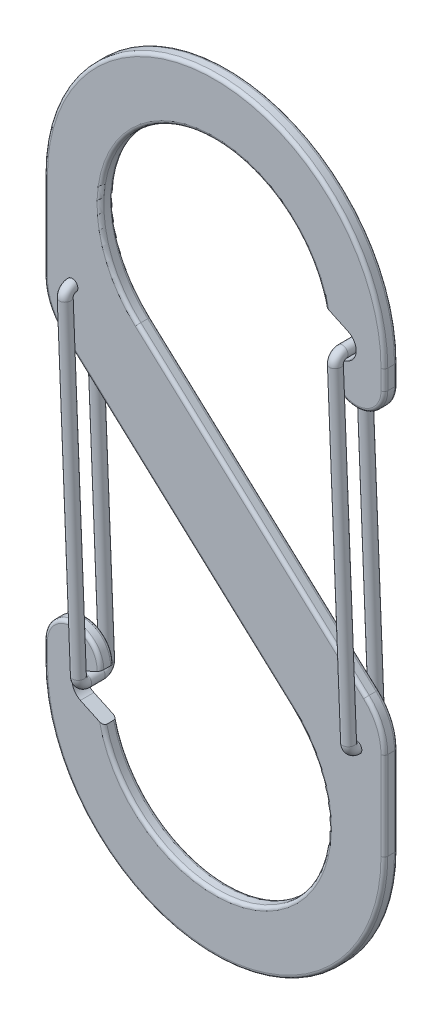
from build123d import *

# Parameters (mm, degrees)
BOSS_EXTRUDE1_DEPTH     = 0.79375
CUT_EXTRUDE1_DEPTH      = 49.955504043
CUT_EXTRUDE1_DEPTH_BACK = 49.955504043
SKETCH2_R               = 0.6604
FILLET1_R               = 6.6675
FILLET2_R               = 0.396875
SKETCH4_R               = 0.6604


with BuildPart() as part:
    # Sketch1 → Boss-Extrude1 (new, symmetric)
    with BuildSketch(Plane.XY):
        with BuildLine():
            Line((7.345443156, 0), (-8.991731826, 14.917615385))
            ThreePointArc((-8.991731826, 14.917615385), (-12.20096244, 19.3836674), (-13.335, 24.765))
            ThreePointArc((-13.335, 24.765), (0, 38.1), (13.335, 24.765))
            Line((13.335, 24.765), (13.335, 22.472049305))
            ThreePointArc((13.335, 22.472049305), (14.302133409, 20.137182714), (16.637, 19.170049305))
            ThreePointArc((16.637, 19.170049305), (18.971866591, 20.137182714), (19.939, 22.472049305))
            Line((19.939, 22.472049305), (19.939, 24.765))
            ThreePointArc((19.939, 24.765), (0, 44.704), (-19.939, 24.765))
            Line((-19.939, 24.765), (-19.939, 11.499285375))
            Line((-19.939, 11.499285375), (-7.345443156, 0))
            Line((-7.345443156, 0), (7.345443156, 0))
        make_face()
    extrude(amount=BOSS_EXTRUDE1_DEPTH, both=True)

    # Sketch2 → Cut-Extrude1 (cut, two sides: drawn at the far end of the back side and taken through both)
    with BuildSketch(Plane.XY.offset(-CUT_EXTRUDE1_DEPTH_BACK)):
        with BuildLine():
            Line((15.68374275, 26.55991435), (0, 33.873363702))
            Line((0, 33.873363702), (0, 16.253836684))
            Line((0, 16.253836684), (15.68374275, 23.567286037))
            ThreePointArc((15.68374275, 23.567286037), (16.637, 25.063600193), (15.68374275, 26.55991435))
        make_face()
        with Locations((-16.637, 15.115503543)):
            Circle(SKETCH2_R)
    extrude(amount=CUT_EXTRUDE1_DEPTH + CUT_EXTRUDE1_DEPTH_BACK, mode=Mode.SUBTRACT)

    # Fillet1
    fillet1_edges = [part.edges().sort_by_distance(p)[0] for p in [
        (-19.939, 11.499285375, 0),
    ]]
    fillet(fillet1_edges, radius=FILLET1_R)

    # Fillet2
    fillet2_edges = [part.edges().sort_by_distance(p)[0] for p in [
        (-0.823144335, 7.458807692, -0.79375),
        (16.637, 19.170049305, -0.79375),
        (19.939, 23.618524653, -0.79375),
        (0, 44.704, -0.79375),
        (-19.939, 19.602519934, -0.79375),
        (-19.37198122, 11.749373567, -0.79375),
        (-0.823144335, 7.458807692, 0.79375),
        (16.637, 19.170049305, 0.79375),
        (19.939, 23.618524653, 0.79375),
        (0, 44.704, 0.79375),
        (-19.939, 19.602519934, 0.79375),
        (-19.37198122, 11.749373567, 0.79375),
        (-6.752681338, 36.263848627, -0.79375),
        (-12.556404534, 4.75817378, -0.79375),
        (-6.752681338, 36.263848627, 0.79375),
        (-12.556404534, 4.75817378, 0.79375),
    ]]
    fillet(fillet2_edges, radius=FILLET2_R)


with BuildPart() as body_2:
    # Mirror1: mirrored copy
    add(part.part.mirror(Plane(origin=(0, 0, 0.79375), x_dir=(0, 0, 1), z_dir=(0, 1, 0))))


with BuildPart() as body_3:
    # Mirror2: mirrored copy
    add(body_2.part.mirror(Plane(origin=(0, 0, 0), x_dir=(0, 0, 1), z_dir=(1, 0, 0))))


with BuildPart() as part_1:
    add(part.part)

    # Combine1: union body 3
    add(body_3.part)


with BuildPart() as body_3_2:
    # Sweep1: sweep along a path in Sketch3
    with BuildLine(Plane(origin=(-15.988891892, -0.656999735, 0), x_dir=(0, 0, -1), z_dir=(0.9991568319995139, 0.04105636453334889, 0))) as sweep1_path:
        Line((0.79375, 15.125413371), (-0.79375, 15.125413371))
        ThreePointArc((-0.79375, 15.125413371), (-0.934066502, 15.067292373), (-0.9921875, 14.926975871))
        Line((-0.9921875, 14.926975871), (-0.9921875, -22.705059896))
        ThreePointArc((-0.9921875, -22.705059896), (-0.934066502, -22.845376398), (-0.79375, -22.903497396))
        Line((-0.79375, -22.903497396), (0.79375, -22.903497396))
        ThreePointArc((0.79375, -22.903497396), (0.934066502, -22.845376398), (0.9921875, -22.705059896))
        Line((0.9921875, -22.705059896), (0.9921875, 14.926975871))
        ThreePointArc((0.9921875, 14.926975871), (0.934066502, 15.067292373), (0.79375, 15.125413371))
    # Sketch4 → Sweep1 (sweep)
    with BuildSketch(Plane.XY.offset(0.79375)):
        with Locations((-16.637, 15.115503543)):
            Circle(SKETCH4_R)
    sweep(path=sweep1_path.line)


with BuildPart() as body_4:
    # Mirror3: mirrored copy
    add(body_3_2.part.mirror(Plane(origin=(0, 0, 0), x_dir=(0, 0, 1), z_dir=(1, 0, 0))))


with BuildPart() as body_5:
    # Mirror4: mirrored copy
    add(body_4.part.mirror(Plane.ZX))


solid = Compound([part_1.part, body_3_2.part, body_5.part])
